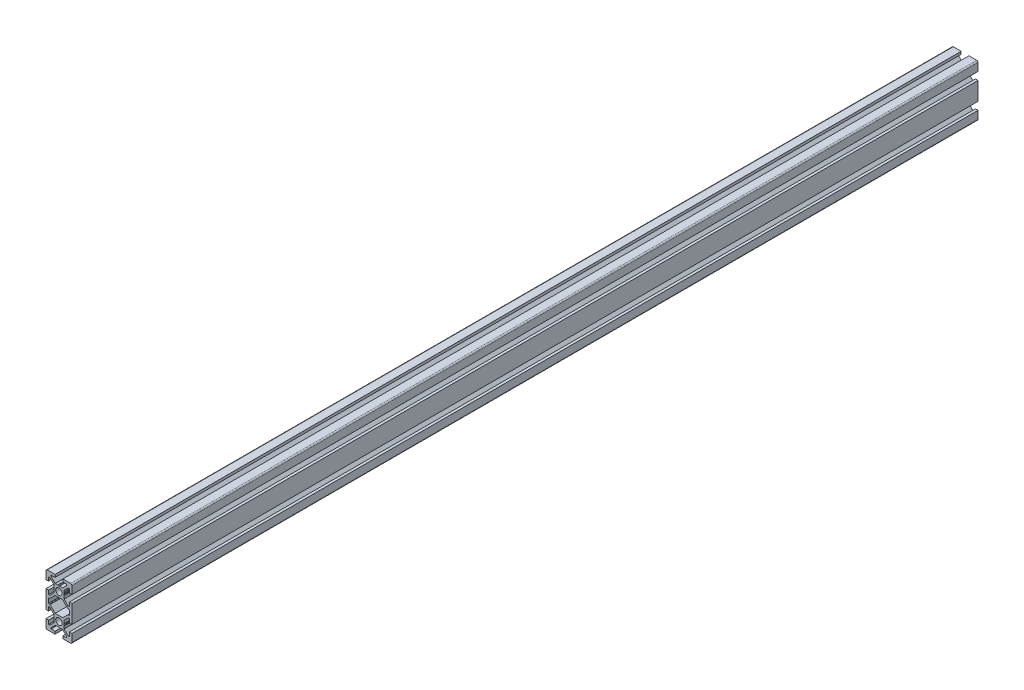
from build123d import *

# Parameters (mm, degrees)
SKETCH1_R           = 2.5
BOSS_EXTRUDE1_DEPTH = 700
SKETCH2_R           = 2
CUT_EXTRUDE1_DEPTH  = 601.666296707


with BuildPart() as part:
    # Sketch1 → Boss-Extrude1 (new body)
    with BuildSketch(Plane(origin=(0, 0, -600), x_dir=(-1, 0, 0), z_dir=(0, 0, -1))):
        with BuildLine():
            Line((10, -7), (10, 7))
            Line((10, 7), (8, 7))
            Line((8, 7), (8, 4))
            Line((8, 4), (7.060660172, 4))
            Line((7.060660172, 4), (4, 7.060660172))
            Line((4, 7.060660172), (4, 7.5))
            Line((4, 7.5), (3.750976592, 8.781114371))
            Line((3.750976592, 8.781114371), (3.933012702, 9.096410162))
            ThreePointArc((3.933012702, 9.096410162), (4, 9.346410162), (3.933012702, 9.596410162))
            Line((3.933012702, 9.596410162), (3.7, 10))
            Line((3.7, 10), (3.933012702, 10.403589838))
            ThreePointArc((3.933012702, 10.403589838), (3.982962913, 10.524180316), (4, 10.653589838))
            Line((4, 10.653589838), (4, 12.939339828))
            Line((4, 12.939339828), (7.060660172, 16))
            Line((7.060660172, 16), (8, 16))
            Line((8, 16), (8, 13))
            Line((8, 13), (10, 13))
            Line((10, 13), (10, 19))
            ThreePointArc((10, 19), (9.707106781, 19.707106781), (9, 20))
            Line((9, 20), (3, 20))
            Line((3, 20), (3, 18))
            Line((3, 18), (6, 18))
            Line((6, 18), (6, 17.060660172))
            Line((6, 17.060660172), (2.939339828, 14))
            Line((2.939339828, 14), (2.5, 14))
            Line((2.5, 14), (1.218885629, 13.750976592))
            Line((1.218885629, 13.750976592), (0.903589838, 13.933012702))
            ThreePointArc((0.903589838, 13.933012702), (0.653589838, 14), (0.403589838, 13.933012702))
            Line((0.403589838, 13.933012702), (0, 13.7))
            Line((0, 13.7), (-0.403589838, 13.933012702))
            ThreePointArc((-0.403589838, 13.933012702), (-0.524180316, 13.982962913), (-0.653589838, 14))
            Line((-0.653589838, 14), (-2.939339828, 14))
            Line((-2.939339828, 14), (-6, 17.060660172))
            Line((-6, 17.060660172), (-6, 18))
            Line((-6, 18), (-3, 18))
            Line((-3, 18), (-3, 20))
            Line((-3, 20), (-9, 20))
            ThreePointArc((-9, 20), (-9.707106781, 19.707106781), (-10, 19))
            Line((-10, 19), (-10, 13))
            Line((-10, 13), (-8, 13))
            Line((-8, 13), (-8, 16))
            Line((-8, 16), (-7.060660172, 16))
            Line((-7.060660172, 16), (-4, 12.939339828))
            Line((-4, 12.939339828), (-4, 12.5))
            Line((-4, 12.5), (-3.750976592, 11.218885629))
            Line((-3.750976592, 11.218885629), (-3.933012702, 10.903589838))
            ThreePointArc((-3.933012702, 10.903589838), (-4, 10.653589838), (-3.933012702, 10.403589838))
            Line((-3.933012702, 10.403589838), (-3.7, 10))
            Line((-3.7, 10), (-3.933012702, 9.596410162))
            ThreePointArc((-3.933012702, 9.596410162), (-3.982962913, 9.475819684), (-4, 9.346410162))
            Line((-4, 9.346410162), (-4, 7.060660172))
            Line((-4, 7.060660172), (-7.060660172, 4))
            Line((-7.060660172, 4), (-8, 4))
            Line((-8, 4), (-8, 7))
            Line((-8, 7), (-10, 7))
            Line((-10, 7), (-10, -7))
            Line((-10, -7), (-8, -7))
            Line((-8, -7), (-8, -4))
            Line((-8, -4), (-7.060660172, -4))
            Line((-7.060660172, -4), (-4, -7.060660172))
            Line((-4, -7.060660172), (-4, -9.346410162))
            ThreePointArc((-4, -9.346410162), (-3.982962913, -9.475819684), (-3.933012702, -9.596410162))
            Line((-3.933012702, -9.596410162), (-3.7, -10))
            Line((-3.7, -10), (-3.933012702, -10.403589838))
            ThreePointArc((-3.933012702, -10.403589838), (-4, -10.653589838), (-3.933012702, -10.903589838))
            Line((-3.933012702, -10.903589838), (-3.750976592, -11.218885629))
            Line((-3.750976592, -11.218885629), (-4, -12.5))
            Line((-4, -12.5), (-4, -12.939339828))
            Line((-4, -12.939339828), (-7.060660172, -16))
            Line((-7.060660172, -16), (-8, -16))
            Line((-8, -16), (-8, -13))
            Line((-8, -13), (-10, -13))
            Line((-10, -13), (-10, -19))
            ThreePointArc((-10, -19), (-9.707106781, -19.707106781), (-9, -20))
            Line((-9, -20), (-3, -20))
            Line((-3, -20), (-3, -18))
            Line((-3, -18), (-6, -18))
            Line((-6, -18), (-6, -17.060660172))
            Line((-6, -17.060660172), (-2.939339828, -14))
            Line((-2.939339828, -14), (-0.653589838, -14))
            ThreePointArc((-0.653589838, -14), (-0.524180316, -13.982962913), (-0.403589838, -13.933012702))
            Line((-0.403589838, -13.933012702), (0, -13.7))
            Line((0, -13.7), (0.403589839, -13.933012702))
            ThreePointArc((0.403589839, -13.933012702), (0.653589839, -14), (0.903589838, -13.933012702))
            Line((0.903589838, -13.933012702), (1.218885629, -13.750976592))
            Line((1.218885629, -13.750976592), (2.5, -14))
            Line((2.5, -14), (2.939339828, -14))
            Line((2.939339828, -14), (6, -17.060660172))
            Line((6, -17.060660172), (6, -18))
            Line((6, -18), (3, -18))
            Line((3, -18), (3, -20))
            Line((3, -20), (9, -20))
            ThreePointArc((9, -20), (9.707106781, -19.707106781), (10, -19))
            Line((10, -19), (10, -13))
            Line((10, -13), (8, -13))
            Line((8, -13), (8, -16))
            Line((8, -16), (7.060660172, -16))
            Line((7.060660172, -16), (4, -12.939339828))
            Line((4, -12.939339828), (4, -10.653589838))
            ThreePointArc((4, -10.653589838), (3.982962913, -10.524180316), (3.933012702, -10.403589838))
            Line((3.933012702, -10.403589838), (3.7, -10))
            Line((3.7, -10), (3.933012702, -9.596410162))
            ThreePointArc((3.933012702, -9.596410162), (4, -9.346410162), (3.933012702, -9.096410162))
            Line((3.933012702, -9.096410162), (3.750976592, -8.781114371))
            Line((3.750976592, -8.781114371), (4, -7.5))
            Line((4, -7.5), (4, -7.060660172))
            Line((4, -7.060660172), (7.060660172, -4))
            Line((7.060660172, -4), (8, -4))
            Line((8, -4), (8, -7))
            Line((8, -7), (10, -7))
        make_face()
        with Locations((0, -10)):
            Circle(SKETCH1_R, mode=Mode.SUBTRACT)
        with Locations((0, 10)):
            Circle(SKETCH1_R, mode=Mode.SUBTRACT)
        with BuildLine():
            Line((8, 1.7), (8, -1.7))
            ThreePointArc((8, -1.7), (7.912132034, -1.912132034), (7.7, -2))
            Line((7.7, -2), (7.063603897, -2))
            ThreePointArc((7.063603897, -2), (6.948798867, -2.02283614), (6.851471863, -2.087867966))
            Line((6.851471863, -2.087867966), (2.939339828, -6))
            Line((2.939339828, -6), (-2.939339828, -6))
            Line((-2.939339828, -6), (-6.851471863, -2.087867966))
            ThreePointArc((-6.851471863, -2.087867966), (-6.948798867, -2.02283614), (-7.063603897, -2))
            Line((-7.063603897, -2), (-7.7, -2))
            ThreePointArc((-7.7, -2), (-7.912132034, -1.912132034), (-8, -1.7))
            Line((-8, -1.7), (-8, 1.7))
            ThreePointArc((-8, 1.7), (-7.912132034, 1.912132034), (-7.7, 2))
            Line((-7.7, 2), (-7.063603897, 2))
            ThreePointArc((-7.063603897, 2), (-6.948798867, 2.02283614), (-6.851471863, 2.087867966))
            Line((-6.851471863, 2.087867966), (-2.939339828, 6))
            Line((-2.939339828, 6), (2.939339828, 6))
            Line((2.939339828, 6), (6.851471863, 2.087867966))
            ThreePointArc((6.851471863, 2.087867966), (6.948798867, 2.02283614), (7.063603897, 2))
            Line((7.063603897, 2), (7.7, 2))
            ThreePointArc((7.7, 2), (7.912132034, 1.912132034), (8, 1.7))
        make_face(mode=Mode.SUBTRACT)
    extrude(amount=-BOSS_EXTRUDE1_DEPTH)

    # Sketch2 → Cut-Extrude1 (cut, through all)
    with BuildSketch(Plane.ZY.offset(10)):
        with Locations((90, 10)):
            Circle(SKETCH2_R)
        with Locations((90, -10)):
            Circle(SKETCH2_R)
    cut_extrude1 = extrude(amount=-CUT_EXTRUDE1_DEPTH, mode=Mode.SUBTRACT)

    # Mirror1: Cut-Extrude1 across plane
    add(cut_extrude1.mirror(Plane.XY.offset(-250)), mode=Mode.SUBTRACT)


solid = part.part
